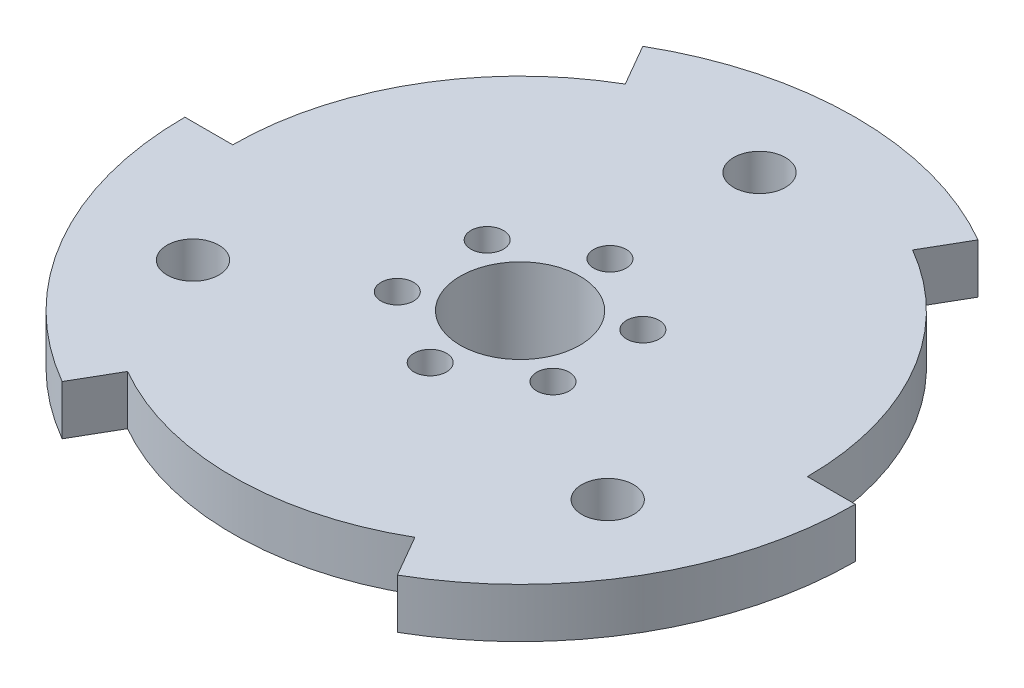
from build123d import *

# Parameters (mm, degrees)
SKETCH7_R               = 16.1
BOSS_EXTRUDE2_DEPTH     = 8.2
SKETCH1_R               = 2.707265749
SKETCH1_R_2             = 6.25
BOSS_EXTRUDE1_DEPTH     = 5.18
CUT_EXTRUDE1_DEPTH      = 52.274012911
CUT_EXTRUDE1_DEPTH_BACK = 52.274012911
SKETCH6_R               = 1.7
SKETCH9_R               = 1.7
SKETCH9_R_2             = 2.707265749
SKETCH9_R_3             = 6.25
CUT_EXTRUDE2_DEPTH      = 52.274012911


with BuildPart() as part:
    # Sketch7 → Boss-Extrude2 (new body)
    with BuildSketch(Plane(origin=(0, 0, 0), x_dir=(1, 0, 0), z_dir=(0, 1, 0))):
        Circle(SKETCH7_R)
    extrude(amount=BOSS_EXTRUDE2_DEPTH)

    # Sketch1 → Boss-Extrude1 (add)
    with BuildSketch(Plane(origin=(0, 8.2, 0), x_dir=(1, 0, 0), z_dir=(0, 1, 0))):
        with BuildLine():
            ThreePointArc((30, 0), (25.980762114, 15), (15, 25.980762114))
            Line((15, 25.980762114), (17.5, 30.310889132))
            ThreePointArc((17.5, 30.310889132), (0, 35), (-17.5, 30.310889132))
            Line((-17.5, 30.310889132), (-15, 25.980762114))
            ThreePointArc((-15, 25.980762114), (-25.980762114, 15), (-30, 0))
            Line((-30, 0), (-35, 0))
            ThreePointArc((-35, 0), (-30.310889132, -17.5), (-17.5, -30.310889132))
            Line((-17.5, -30.310889132), (-15, -25.980762114))
            ThreePointArc((-15, -25.980762114), (0, -30), (15, -25.980762114))
            Line((15, -25.980762114), (17.5, -30.310889132))
            ThreePointArc((17.5, -30.310889132), (30.310889132, -17.5), (35, 0))
            Line((35, 0), (30, 0))
        make_face()
        with Locations((-21.650635095, -12.5)):
            Circle(SKETCH1_R, mode=Mode.SUBTRACT)
        with Locations((21.650635095, -12.5)):
            Circle(SKETCH1_R, mode=Mode.SUBTRACT)
        Circle(SKETCH1_R_2, mode=Mode.SUBTRACT)
        with Locations((0, 25)):
            Circle(SKETCH1_R, mode=Mode.SUBTRACT)
    extrude(amount=BOSS_EXTRUDE1_DEPTH)

    # Sketch6 → Cut-Extrude1 (cut, two sides: drawn at the far end of the back side and taken through both)
    with BuildSketch(Plane(origin=(0, 13.38, 0), x_dir=(1, 0, 0), z_dir=(0, 1, 0)).offset(-CUT_EXTRUDE1_DEPTH_BACK)):
        with Locations((0, -9.385)):
            Circle(SKETCH6_R)
        with Locations((-8.127648415, -4.6925)):
            Circle(SKETCH6_R)
        with Locations((-8.127648415, 4.6925)):
            Circle(SKETCH6_R)
        with Locations((0, 9.385)):
            Circle(SKETCH6_R)
        with Locations((8.127648415, 4.6925)):
            Circle(SKETCH6_R)
        with Locations((8.127648415, -4.6925)):
            Circle(SKETCH6_R)
    extrude(amount=CUT_EXTRUDE1_DEPTH + CUT_EXTRUDE1_DEPTH_BACK, mode=Mode.SUBTRACT)

    # Sketch9 → Cut-Extrude2 (cut, through all)
    with BuildSketch(Plane(origin=(0, 13.38, 0), x_dir=(1, 0, 0), z_dir=(0, 1, 0))):
        with Locations((8.127648415, -4.6925)):
            Circle(SKETCH9_R)
        with Locations((8.127648415, 4.6925)):
            Circle(SKETCH9_R)
        with Locations((0, 9.385)):
            Circle(SKETCH9_R)
        with Locations((-8.127648415, 4.6925)):
            Circle(SKETCH9_R)
        with Locations((-8.127648415, -4.6925)):
            Circle(SKETCH9_R)
        with Locations((21.650635095, -12.5)):
            Circle(SKETCH9_R_2)
        with Locations((0, 25)):
            Circle(SKETCH9_R_2)
        with Locations((-21.650635095, -12.5)):
            Circle(SKETCH9_R_2)
        Circle(SKETCH9_R_3)
    extrude(amount=-CUT_EXTRUDE2_DEPTH, mode=Mode.SUBTRACT)


solid = part.part
